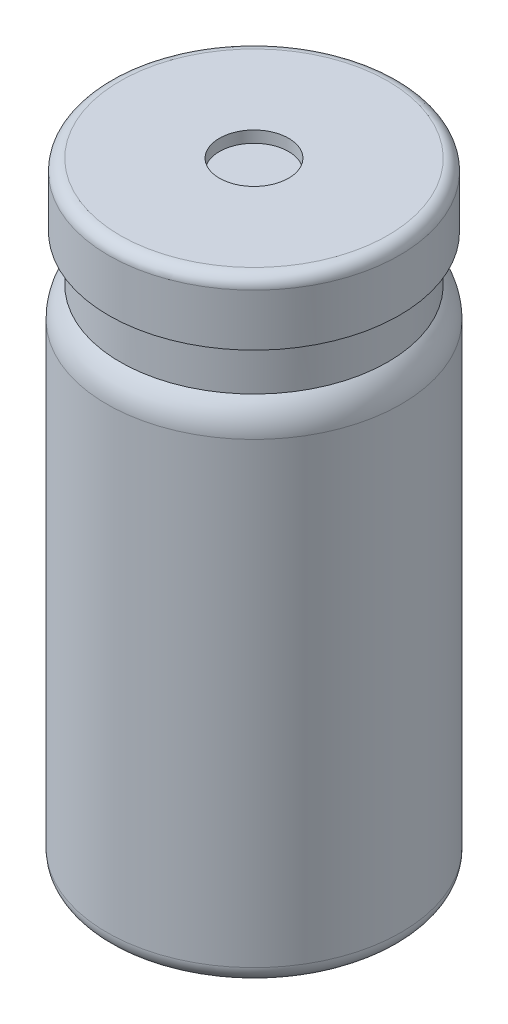
from build123d import *

# Parameters (mm, degrees)
FILLET1_R = 3.5
FILLET2_R = 1.5
FILLET3_R = 1


with BuildPart() as part:
    # Sketch1 → Revolve1 (revolve)
    with BuildSketch(Plane.XY):
        Polygon((0, 0), (-12.745, 0), (-12.745, 43.73), (-11.595, 43.73), (-11.595, 51.23), (0, 51.23), align=None)
    revolve(axis=Axis((0, 51.23, 0), (0, -1, 0)))

    # Fillet1
    # the kernel refuses this fillet: 3.5 mm, written as the material it takes off along each edge
    with BuildSketch(Plane(origin=(0, 43.73, 0), x_dir=(-1, 0, 0), z_dir=(0, 0, 1))) as fillet1_piece_1:
        with BuildLine():
            CenterArc((9.245, 2.59374247), FILLET1_R, 312.177418601, 47.822581399)
            Line((11.595, 0), (11.642, -0.051874849))
            ThreePointArc((11.642, -0.051874849), (12.17, -0.07), (12.745, -0.07))
            Line((12.745, -0.07), (12.815, 0))
            Line((12.815, 0), (12.815, 2.59374247))
            Line((12.815, 2.59374247), (12.745, 2.59374247))
        make_face()
    revolve(axis=Axis((0, 43.73, 0), (0, -1, 0)), mode=Mode.SUBTRACT)

    # Fillet2
    fillet2_edges = [part.edges().sort_by_distance(p)[0] for p in [
        (12.745, 0, 0),
    ]]
    fillet(fillet2_edges, radius=FILLET2_R)

    # Sketch2 → Revolve2 (revolve)
    with BuildSketch(Plane(origin=(0, 0, 0), x_dir=(0, 0, -1), z_dir=(1, 0, 0)), mode=Mode.PRIVATE) as revolve2_sk:
        Polygon((3, 52.23), (11.595, 52.23), (11.595, 47.73), (12.595, 47.73), (12.595, 53.23), (3, 53.23), align=None)
    revolve(revolve2_sk.sketch.rotate(Axis((0, 51.23, 0), (0, -1, 0)), 180), axis=Axis((0, 51.23, 0), (0, -1, 0)))

    # Fillet3
    fillet3_edges = [part.edges().sort_by_distance(p)[0] for p in [
        (0, 53.23, -12.595),
    ]]
    fillet(fillet3_edges, radius=FILLET3_R)


solid = part.part
